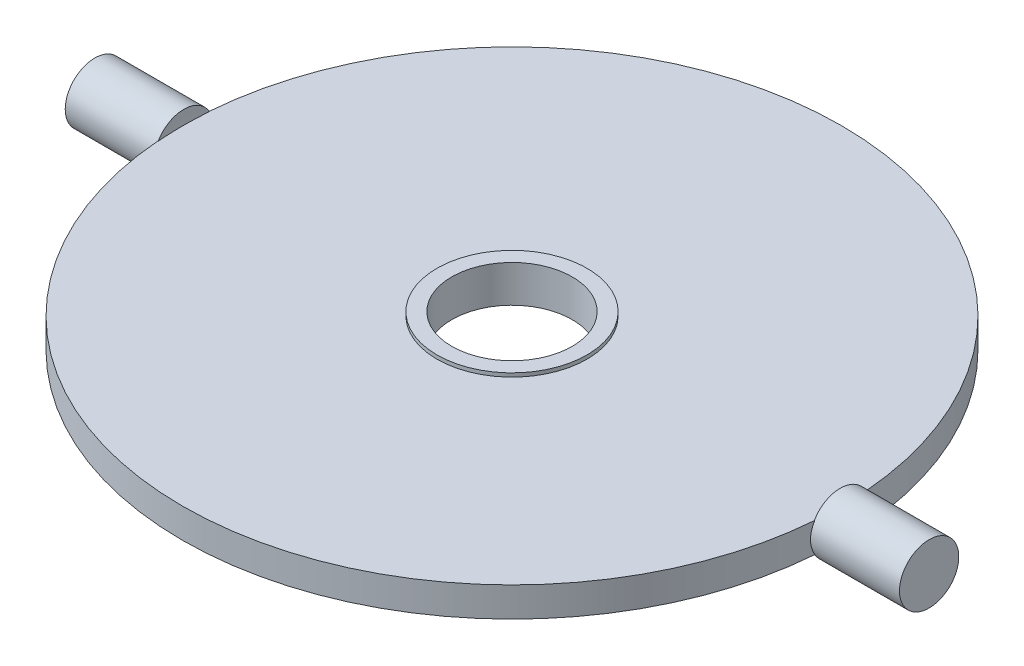
from build123d import *

# Parameters (mm, degrees)
SKETCH1_R           = 10.125
BOSS_EXTRUDE1_DEPTH = 2
SKETCH1_7_R         = 10.125
SKETCH1_7_R_2       = 8.125
BOSS_EXTRUDE2_DEPTH = 2.5


with BuildPart() as part:
    # Sketch1 → Boss-Extrude1 (new, symmetric)
    with BuildSketch(Plane(origin=(0, 0, 0), x_dir=(1, 0, 0), z_dir=(0, 1, 0))):
        with BuildLine():
            ThreePointArc((44.269656651, 4), (0, 44.45), (-44.269656651, 4))
            ThreePointArc((-44.269656651, 4), (-44.404891274, 2.002031701), (-44.45, 0))
            ThreePointArc((-44.45, 0), (-44.404891274, -2.002031701), (-44.269656651, -4))
            ThreePointArc((-44.269656651, -4), (0, -44.45), (44.269656651, -4))
            ThreePointArc((44.269656651, -4), (44.404891274, -2.002031701), (44.45, 0))
            ThreePointArc((44.45, 0), (44.404891274, 2.002031701), (44.269656651, 4))
        make_face()
        Circle(SKETCH1_R, mode=Mode.SUBTRACT)
    extrude(amount=BOSS_EXTRUDE1_DEPTH, both=True)

    # Sketch1<6> → Revolve1 (revolve)
    with BuildSketch(Plane(origin=(0, 0, 0), x_dir=(1, 0, 0), z_dir=(0, 1, 0))):
        with BuildLine():
            Line((-44.45, 0), (-56.269656651, 0))
            Line((-56.269656651, 0), (-56.269656651, -4))
            Line((-56.269656651, -4), (-44.269656651, -4))
            ThreePointArc((-44.269656651, -4), (-44.404891274, -2.002031701), (-44.45, 0))
        make_face()
        with BuildLine():
            Line((56.269656651, 0), (44.45, 0))
            ThreePointArc((44.45, 0), (44.404891274, -2.002031701), (44.269656651, -4))
            Line((44.269656651, -4), (56.269656651, -4))
            Line((56.269656651, -4), (56.269656651, 0))
        make_face()
    revolve(axis=Axis((-76.43543075, 0, 0), (1, 0, 0)))

    # Sketch1<7> → Boss-Extrude2 (add, symmetric)
    with BuildSketch(Plane(origin=(0, 0, 0), x_dir=(1, 0, 0), z_dir=(0, 1, 0))):
        Circle(SKETCH1_7_R)
        Circle(SKETCH1_7_R_2, mode=Mode.SUBTRACT)
    extrude(amount=BOSS_EXTRUDE2_DEPTH, both=True)


solid = part.part
